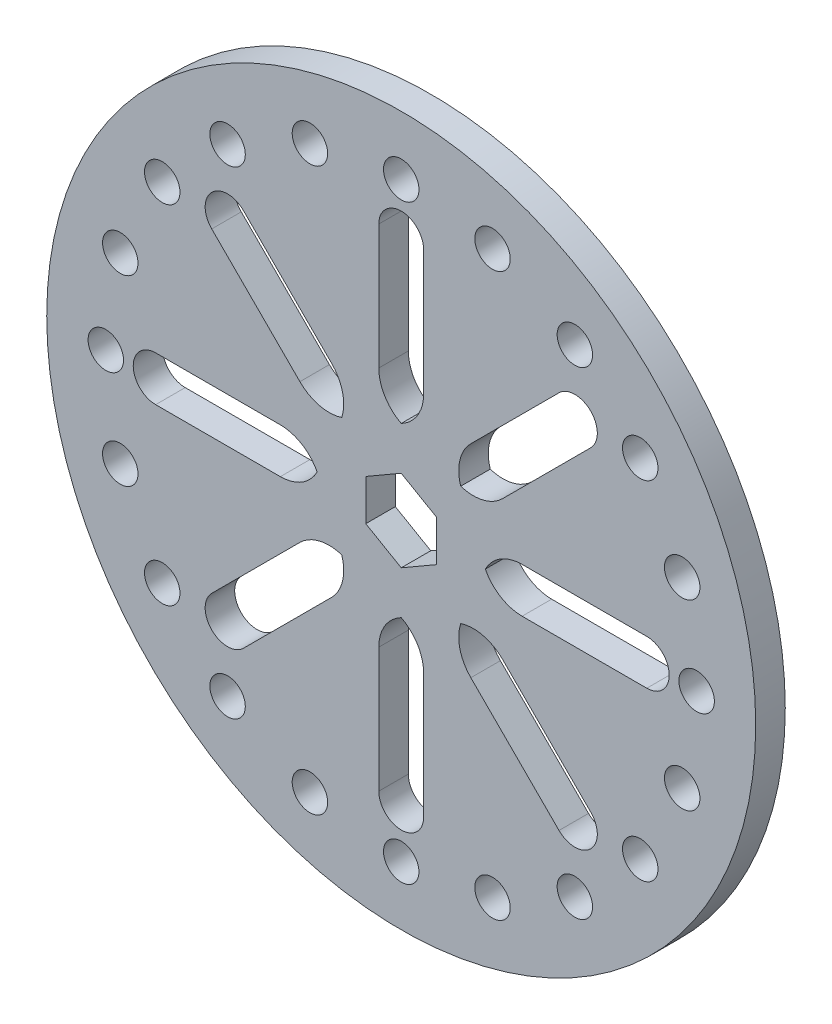
from build123d import *

# Parameters (mm, degrees)
SKETCH1_R           = 60
BOSS_EXTRUDE1_DEPTH = 5
SKETCH2_R           = 2
SKETCH2_R_2         = 3
CUT_EXTRUDE2_DEPTH  = 5
FILLET1_R           = 7
CUT_EXTRUDE3_DEPTH  = 10


with BuildPart() as part:
    # Sketch1 → Boss-Extrude1 (new body)
    with BuildSketch(Plane.XY):
        Circle(SKETCH1_R)
    extrude(amount=BOSS_EXTRUDE1_DEPTH)

    # Sketch2 → Cut-Extrude2 (cut)
    with BuildSketch(Plane.XY.offset(5)):
        Circle(SKETCH2_R)
        with Locations((0, 50)):
            Circle(SKETCH2_R_2)
        with Locations((15.450849719, 47.552825815)):
            Circle(SKETCH2_R_2)
        with Locations((29.389262615, 40.450849719)):
            Circle(SKETCH2_R_2)
        with Locations((40.450849719, 29.389262615)):
            Circle(SKETCH2_R_2)
        with Locations((47.552825815, 15.450849719)):
            Circle(SKETCH2_R_2)
        with Locations((50, 0)):
            Circle(SKETCH2_R_2)
        with Locations((47.552825815, -15.450849719)):
            Circle(SKETCH2_R_2)
        with Locations((40.450849719, -29.389262615)):
            Circle(SKETCH2_R_2)
        with Locations((29.389262615, -40.450849719)):
            Circle(SKETCH2_R_2)
        with Locations((15.450849719, -47.552825815)):
            Circle(SKETCH2_R_2)
        with Locations((0, -50)):
            Circle(SKETCH2_R_2)
        with Locations((-15.450849719, -47.552825815)):
            Circle(SKETCH2_R_2)
        with Locations((-29.389262615, -40.450849719)):
            Circle(SKETCH2_R_2)
        with Locations((-40.450849719, -29.389262615)):
            Circle(SKETCH2_R_2)
        with Locations((-47.552825815, -15.450849719)):
            Circle(SKETCH2_R_2)
        with Locations((-50, 0)):
            Circle(SKETCH2_R_2)
        with Locations((-47.552825815, 15.450849719)):
            Circle(SKETCH2_R_2)
        with Locations((-40.450849719, 29.389262615)):
            Circle(SKETCH2_R_2)
        with Locations((-29.389262615, 40.450849719)):
            Circle(SKETCH2_R_2)
        with Locations((-15.450849719, 47.552825815)):
            Circle(SKETCH2_R_2)
        with BuildLine():
            Line((-26.704527531, 32.073997698), (-6.627939737, 11.997409903))
            ThreePointArc((-6.627939737, 11.997409903), (-9.691940712, 9.691940712), (-11.997409903, 6.627939737))
            Line((-11.997409903, 6.627939737), (-32.073997698, 26.704527531))
            ThreePointArc((-32.073997698, 26.704527531), (-32.073997698, 32.073997698), (-26.704527531, 32.073997698))
        make_face()
        with BuildLine():
            Line((3.796788766, 41.562693778), (3.796788766, 13.170111032))
            ThreePointArc((3.796788766, 13.170111032), (0, 13.706474001), (-3.796788766, 13.170111032))
            Line((-3.796788766, 13.170111032), (-3.796788766, 41.562693778))
            ThreePointArc((-3.796788766, 41.562693778), (0, 45.359482544), (3.796788766, 41.562693778))
        make_face()
        with BuildLine():
            Line((32.073997698, 26.704527531), (11.997409903, 6.627939737))
            ThreePointArc((11.997409903, 6.627939737), (9.691940712, 9.691940712), (6.627939737, 11.997409903))
            Line((6.627939737, 11.997409903), (26.704527531, 32.073997698))
            ThreePointArc((26.704527531, 32.073997698), (32.073997698, 32.073997698), (32.073997698, 26.704527531))
        make_face()
        with BuildLine():
            Line((41.562693778, -3.796788766), (13.170111032, -3.796788766))
            ThreePointArc((13.170111032, -3.796788766), (13.706474001, 0), (13.170111032, 3.796788766))
            Line((13.170111032, 3.796788766), (41.562693778, 3.796788766))
            ThreePointArc((41.562693778, 3.796788766), (45.359482544, 0), (41.562693778, -3.796788766))
        make_face()
        with BuildLine():
            Line((26.704527531, -32.073997698), (6.627939737, -11.997409903))
            ThreePointArc((6.627939737, -11.997409903), (9.691940712, -9.691940712), (11.997409903, -6.627939737))
            Line((11.997409903, -6.627939737), (32.073997698, -26.704527531))
            ThreePointArc((32.073997698, -26.704527531), (32.073997698, -32.073997698), (26.704527531, -32.073997698))
        make_face()
        with BuildLine():
            Line((-3.796788766, -41.562693778), (-3.796788766, -13.170111032))
            ThreePointArc((-3.796788766, -13.170111032), (0, -13.706474001), (3.796788766, -13.170111032))
            Line((3.796788766, -13.170111032), (3.796788766, -41.562693778))
            ThreePointArc((3.796788766, -41.562693778), (0, -45.359482544), (-3.796788766, -41.562693778))
        make_face()
        with BuildLine():
            Line((-32.073997698, -26.704527531), (-11.997409903, -6.627939737))
            ThreePointArc((-11.997409903, -6.627939737), (-9.691940712, -9.691940712), (-6.627939737, -11.997409903))
            Line((-6.627939737, -11.997409903), (-26.704527531, -32.073997698))
            ThreePointArc((-26.704527531, -32.073997698), (-32.073997698, -32.073997698), (-32.073997698, -26.704527531))
        make_face()
        with BuildLine():
            Line((-41.562693778, 3.796788766), (-13.170111032, 3.796788766))
            ThreePointArc((-13.170111032, 3.796788766), (-13.706474001, 0), (-13.170111032, -3.796788766))
            Line((-13.170111032, -3.796788766), (-41.562693778, -3.796788766))
            ThreePointArc((-41.562693778, -3.796788766), (-45.359482544, 0), (-41.562693778, 3.796788766))
        make_face()
    extrude(amount=-CUT_EXTRUDE2_DEPTH, mode=Mode.SUBTRACT)

    # Fillet1
    # the kernel refuses this fillet: 7 mm, written as the material it adds along each edge
    with BuildSketch(Plane(origin=(11.997409903, 6.627939737, 5), x_dir=(-0.6614265480473352, 0.7500099476261538, 0), z_dir=(0, 0, -1)), Plane(origin=(13.170111032, -3.796788766, 5), x_dir=(0.06263792254265388, 0.9980363173049068, 0), z_dir=(0, 0, -1)), Plane(origin=(6.627939737, -11.997409903, 5), x_dir=(0.7500099476260863, 0.661426548047412, 0), z_dir=(0, 0, -1)), Plane(origin=(-3.796788766, -13.170111032, 5), x_dir=(0.998036317304904, -0.06263792254269633, 0), z_dir=(0, 0, -1)), Plane(origin=(-11.997409903, -6.627939737, 5), x_dir=(0.6614265480472753, -0.7500099476262067, 0), z_dir=(0, 0, -1)), Plane(origin=(-13.170111032, 3.796788766, 5), x_dir=(-0.06263792254277421, -0.9980363173048992, 0), z_dir=(0, 0, -1)), Plane(origin=(-6.627939737, 11.997409903, 5), x_dir=(-0.7500099476261984, -0.6614265480472847, 0), z_dir=(0, 0, -1)), Plane(origin=(3.796788766, 13.170111032, 5), x_dir=(-0.9980363173048974, 0.06263792254280169, 0), z_dir=(0, 0, -1))) as fillet1_piece_1:
        with BuildLine():
            CenterArc((7.442703057, 6.834325481), FILLET1_R, 176.408760408, 81.100827227)
            Line((0.456448836, 7.272790939), (0, 0))
            ThreePointArc((0, 0), (2.964384683, 0.324401927), (5.928769366, 0))
        make_face()
    extrude(amount=5)
    with BuildSketch(Plane(origin=(6.627939737, 11.997409903, 5), x_dir=(0.7071067811865476, 0.7071067811865476, 0), z_dir=(0, 0, -1)), Plane(origin=(13.170111032, 3.796788766, 5), x_dir=(1, 0, 0), z_dir=(0, 0, -1)), Plane(origin=(-6.627939737, -11.997409903, 5), x_dir=(-0.7071067811865477, -0.7071067811865474, 0), z_dir=(0, 0, -1)), Plane(origin=(-13.170111032, -3.796788766, 5), x_dir=(-1, 0, 0), z_dir=(0, 0, -1)), Plane(origin=(-3.796788766, 13.170111032, 5), x_dir=(0, 1, 0), z_dir=(0, 0, -1))) as fillet1_piece_2:
        with BuildLine():
            CenterArc((7.287100492, 7), FILLET1_R, 188.899172773, 81.100827227)
            ThreePointArc((0.371365796, 5.917127144), (0.509447803, 2.938243709), (0, 0))
            Line((0, 0), (7.287100492, 0))
        make_face()
    extrude(amount=5)
    with BuildSketch(Plane(origin=(11.997409903, -6.627939737, 5), x_dir=(-0.661426548047024, -0.7500099476264284, 0), z_dir=(0, 0, -1)), Plane(origin=(3.796788766, -13.170111032, 5), x_dir=(-0.9980363173048815, -0.06263792254305393, 0), z_dir=(0, 0, -1)), Plane(origin=(-11.997409903, 6.627939737, 5), x_dir=(0.6614265480472289, 0.7500099476262477, 0), z_dir=(0, 0, -1))) as fillet1_piece_3:
        with BuildLine():
            CenterArc((7.442703057, -6.834325481), FILLET1_R, 102.490412365, 81.100827227)
            Line((0.456448836, -7.272790939), (0, 0))
            ThreePointArc((0, 0), (2.964384683, -0.324401927), (5.928769366, 0))
        make_face()
    extrude(amount=5)

    # Sketch3 → Cut-Extrude3 (cut)
    with BuildSketch(Plane.XY.offset(5)):
        Polygon((0, 6.92820323), (-6, 3.464101615), (-6, -3.464101615), (0, -6.92820323), (6, -3.464101615), (6, 3.464101615), align=None)
    extrude(amount=-CUT_EXTRUDE3_DEPTH, mode=Mode.SUBTRACT)


solid = part.part
